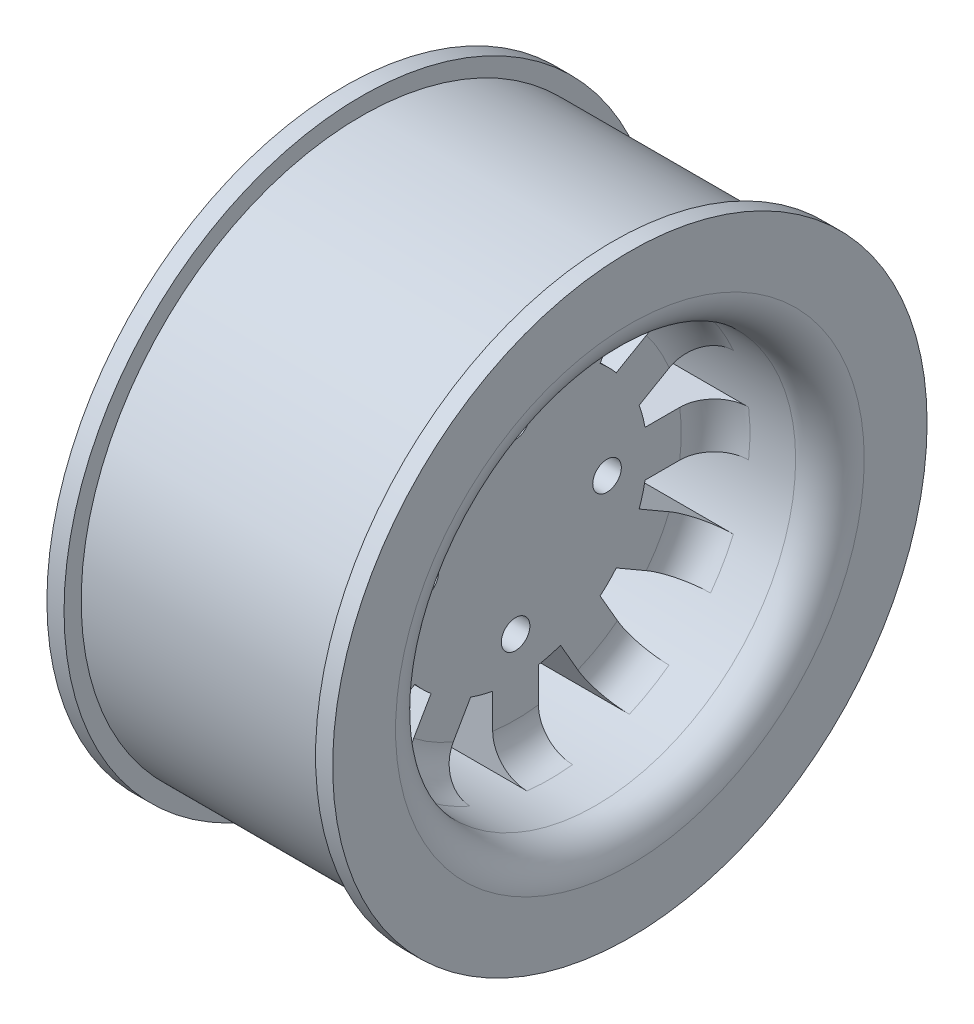
from build123d import *
from build123d.topology import SkipClean

# Parameters (mm, degrees)
SKETCH_1_R          = 24.5
EXTRUDE_1_DEPTH     = 22
SKETCH_2_R          = 26
EXTRUDE_2_DEPTH     = 1.5
EXTRUDE_START       = 1.5
SKETCH_3_R          = 26
EXTRUDE_3_DEPTH     = 1.5
SKETCH_4_R          = 17.5
CUT_EXTRUDE_1_DEPTH = 10
SKETCH_5_R          = 1.25
CUT_EXTRUDE_2_DEPTH = 40.711459303
SKETCH_6_R          = 4.3
SKETCH_6_R_2        = 2.5
EXTRUDE_4_DEPTH     = 10
CUT_EXTRUDE_START   = -10
SKETCH_7_R          = 17.5
CUT_EXTRUDE_3_DEPTH = 10
CUT_EXTRUDE_4_DEPTH = 40.711459303
FILLET_1_R          = 3
FILLET_2_R          = 3


with BuildPart() as part:
    # 草图1 → 凸台-拉伸1 (new body)
    with BuildSketch(Plane(origin=(0, 0, 0), x_dir=(0, 0, -1), z_dir=(1, 0, 0))):
        Circle(SKETCH_1_R)
    extrude(amount=EXTRUDE_1_DEPTH)

    # 草图2 → 凸台-拉伸2 (add)
    with BuildSketch(Plane(origin=(22, 0, 0), x_dir=(0, 0, -1), z_dir=(1, 0, 0))):
        Circle(SKETCH_2_R)
    extrude(amount=EXTRUDE_2_DEPTH)

    # 草图3 → 凸台-拉伸3 (add)
    with BuildSketch(Plane.ZY.offset(EXTRUDE_START)):
        with Locations(Location((0, 0, 0), (0, 0, 180))):
            Circle(SKETCH_3_R)
    extrude(amount=-EXTRUDE_3_DEPTH)

    # 草图4 → 切除-拉伸1 (cut)
    with BuildSketch(Plane.ZY.offset(1.5)):
        Circle(SKETCH_4_R)
    extrude(amount=-CUT_EXTRUDE_1_DEPTH, mode=Mode.SUBTRACT)

    # 草图5 → 切除-拉伸2 (cut, through all)
    with BuildSketch(Plane.ZY.offset(-8.5)):
        with Locations((0, 8)):
            Circle(SKETCH_5_R)
        with Locations((8, 0)):
            Circle(SKETCH_5_R)
        with Locations((0, -8)):
            Circle(SKETCH_5_R)
        with Locations((-8, 0)):
            Circle(SKETCH_5_R)
    extrude(amount=-CUT_EXTRUDE_2_DEPTH, mode=Mode.SUBTRACT)

    # 草图6 → 凸台-拉伸4 (add, through all)
    with BuildSketch(Plane.ZY.offset(-8.5)):
        Circle(SKETCH_6_R)
        Circle(SKETCH_6_R_2, mode=Mode.SUBTRACT)
    extrude(amount=EXTRUDE_4_DEPTH)

    # 草图7 → 切除-拉伸3 (cut)
    with BuildSketch(Plane(origin=(23.5, 0, 0), x_dir=(0, 0, -1), z_dir=(1, 0, 0)).offset(CUT_EXTRUDE_START)):
        with Locations(Location((0, 0, 0), (0, 0, 180))):
            Circle(SKETCH_7_R)
    extrude(amount=CUT_EXTRUDE_3_DEPTH, mode=Mode.SUBTRACT)

    # 草图8 → 切除-拉伸4 (cut, through all)
    with SkipClean():  # the faces are left unmerged after this step: merging them gives an invalid solid
        with BuildSketch(Plane(origin=(13.5, 0, 0), x_dir=(0, 0, -1), z_dir=(1, 0, 0))):
            with BuildLine():
                Line((2, 11.324751653), (2, 17.385338651))
                ThreePointArc((2, 17.385338651), (4.529333289, 16.90370196), (6.960618518, 16.056144925))
                Line((6.960618518, 16.056144925), (3.930325019, 10.807522623))
                ThreePointArc((3.930325019, 10.807522623), (2.976419019, 11.108147002), (2, 11.324751653))
            make_face()
            with BuildLine():
                Line((-2, 11.324751653), (-2, 17.385338651))
                ThreePointArc((-2, 17.385338651), (-4.529333289, 16.90370196), (-6.960618518, 16.056144925))
                Line((-6.960618518, 16.056144925), (-3.930325019, 10.807522623))
                ThreePointArc((-3.930325019, 10.807522623), (-2.976419019, 11.108147002), (-2, 11.324751653))
            make_face()
            with BuildLine():
                Line((7.394426634, 8.807522623), (10.424720133, 14.056144925))
                ThreePointArc((10.424720133, 14.056144925), (12.374368671, 12.374368671), (14.056144925, 10.424720133))
                Line((14.056144925, 10.424720133), (8.807522623, 7.394426634))
                ThreePointArc((8.807522623, 7.394426634), (8.131727984, 8.131727984), (7.394426634, 8.807522623))
            make_face()
            with BuildLine():
                Line((10.807522623, 3.930325019), (16.056144925, 6.960618518))
                ThreePointArc((16.056144925, 6.960618518), (16.90370196, 4.529333289), (17.385338651, 2))
                Line((17.385338651, 2), (11.324751653, 2))
                ThreePointArc((11.324751653, 2), (11.108147002, 2.976419019), (10.807522623, 3.930325019))
            make_face()
            with BuildLine():
                Line((11.324751653, -2), (17.385338651, -2))
                ThreePointArc((17.385338651, -2), (16.90370196, -4.529333289), (16.056144925, -6.960618518))
                Line((16.056144925, -6.960618518), (10.807522623, -3.930325019))
                ThreePointArc((10.807522623, -3.930325019), (11.108147002, -2.976419019), (11.324751653, -2))
            make_face()
            with BuildLine():
                Line((8.807522623, -7.394426634), (14.056144925, -10.424720133))
                ThreePointArc((14.056144925, -10.424720133), (12.374368671, -12.374368671), (10.424720133, -14.056144925))
                Line((10.424720133, -14.056144925), (7.394426634, -8.807522623))
                ThreePointArc((7.394426634, -8.807522623), (8.131727984, -8.131727984), (8.807522623, -7.394426634))
            make_face()
            with BuildLine():
                Line((3.930325019, -10.807522623), (6.960618518, -16.056144925))
                ThreePointArc((6.960618518, -16.056144925), (4.529333289, -16.90370196), (2, -17.385338651))
                Line((2, -17.385338651), (2, -11.324751653))
                ThreePointArc((2, -11.324751653), (2.976419019, -11.108147002), (3.930325019, -10.807522623))
            make_face()
            with BuildLine():
                Line((-2, -11.324751653), (-2, -17.385338651))
                ThreePointArc((-2, -17.385338651), (-4.529333289, -16.90370196), (-6.960618518, -16.056144925))
                Line((-6.960618518, -16.056144925), (-3.930325019, -10.807522623))
                ThreePointArc((-3.930325019, -10.807522623), (-2.976419019, -11.108147002), (-2, -11.324751653))
            make_face()
            with BuildLine():
                Line((-7.394426634, -8.807522623), (-10.424720133, -14.056144925))
                ThreePointArc((-10.424720133, -14.056144925), (-12.374368671, -12.374368671), (-14.056144925, -10.424720133))
                Line((-14.056144925, -10.424720133), (-8.807522623, -7.394426634))
                ThreePointArc((-8.807522623, -7.394426634), (-8.131727984, -8.131727984), (-7.394426634, -8.807522623))
            make_face()
            with BuildLine():
                Line((-10.807522623, -3.930325019), (-16.056144925, -6.960618518))
                ThreePointArc((-16.056144925, -6.960618518), (-16.90370196, -4.529333289), (-17.385338651, -2))
                Line((-17.385338651, -2), (-11.324751653, -2))
                ThreePointArc((-11.324751653, -2), (-11.108147002, -2.976419019), (-10.807522623, -3.930325019))
            make_face()
            with BuildLine():
                Line((-11.324751653, 2), (-17.385338651, 2))
                ThreePointArc((-17.385338651, 2), (-16.90370196, 4.529333289), (-16.056144925, 6.960618518))
                Line((-16.056144925, 6.960618518), (-10.807522623, 3.930325019))
                ThreePointArc((-10.807522623, 3.930325019), (-11.108147002, 2.976419019), (-11.324751653, 2))
            make_face()
            with BuildLine():
                Line((-8.807522623, 7.394426634), (-14.056144925, 10.424720133))
                ThreePointArc((-14.056144925, 10.424720133), (-12.374368671, 12.374368671), (-10.424720133, 14.056144925))
                Line((-10.424720133, 14.056144925), (-7.394426634, 8.807522623))
                ThreePointArc((-7.394426634, 8.807522623), (-8.131727984, 8.131727984), (-8.807522623, 7.394426634))
            make_face()
        extrude(amount=-CUT_EXTRUDE_4_DEPTH, mode=Mode.SUBTRACT)
    add(part.part.scale(1), mode=Mode.REPLACE)  # the faces are merged on a copy

    # 圆角1
    # the kernel refuses this fillet: 3 mm, written as the material it adds along each edge
    with BuildSketch(Plane(origin=(13.5, 0, 0), x_dir=(0, -0.019511048393671137, -0.9998096413770873), z_dir=(0, -0.9998096413770873, 0.019511048393671137))) as fillet_1_piece_1_section:
        with BuildLine():
            CenterArc((17.5 - FILLET_1_R, FILLET_1_R), FILLET_1_R, 270, 90)
            Line((17.5 - FILLET_1_R, 0), (17.5, 0))
            Line((17.5, 0), (17.5, FILLET_1_R))
        make_face()
    fillet_1_piece_1 = revolve(axis=Axis((13.5, 0, 0), (1, 0, 0)), revolution_arc=62.235943332, mode=Mode.PRIVATE)
    fillet_1_piece_1 = split(fillet_1_piece_1, bisect_by=Plane(origin=(14.181189147, 2, -16.789803042), z_dir=(0, -1, 0)), keep=Keep.TOP, mode=Mode.PRIVATE)
    add(fillet_1_piece_1)
    with BuildSketch(Plane(origin=(13.5, 0, 0), x_dir=(0, -0.019511048393671137, -0.9998096413770873), z_dir=(0, -0.9998096413770873, 0.019511048393671137))) as fillet_1_piece_2_section:
        with BuildLine():
            CenterArc((17.5 - FILLET_1_R, FILLET_1_R), FILLET_1_R, 270, 90)
            Line((17.5 - FILLET_1_R, 0), (17.5, 0))
            Line((17.5, 0), (17.5, FILLET_1_R))
        make_face()
    fillet_1_piece_2 = revolve(axis=Axis((13.5, 0, 0), (1, 0, 0)), revolution_arc=62.235943332, mode=Mode.PRIVATE)
    fillet_1_piece_2 = split(fillet_1_piece_2, bisect_by=Plane(origin=(14.179112332, 10.122465498, -13.53262454), z_dir=(0, -0.8660254037844387, -0.5)), keep=Keep.TOP, mode=Mode.PRIVATE)
    fillet_1_piece_2 = split(fillet_1_piece_2, bisect_by=Plane(origin=(14.179112332, 6.658363883, -15.53262454), z_dir=(0, 0.8660254037844387, 0.5000000000000001)), keep=Keep.TOP, mode=Mode.PRIVATE)
    add(fillet_1_piece_2)
    with BuildSketch(Plane(origin=(13.5, 0, 0), x_dir=(0, -0.019511048393671137, -0.9998096413770873), z_dir=(0, -0.9998096413770873, 0.019511048393671137))) as fillet_1_piece_3_section:
        with BuildLine():
            CenterArc((17.5 - FILLET_1_R, FILLET_1_R), FILLET_1_R, 270, 90)
            Line((17.5 - FILLET_1_R, 0), (17.5, 0))
            Line((17.5, 0), (17.5, FILLET_1_R))
        make_face()
    fillet_1_piece_3 = revolve(axis=Axis((13.5, 0, 0), (1, 0, 0)), revolution_arc=62.235943332, mode=Mode.PRIVATE)
    fillet_1_piece_3 = split(fillet_1_piece_3, bisect_by=Plane(origin=(14.181189404, 13.540395949, -10.126952323), z_dir=(0, 0.5000000000000011, 0.866025403784438)), keep=Keep.TOP, mode=Mode.PRIVATE)
    add(fillet_1_piece_3)
    with BuildSketch(Plane(origin=(13.5, 0, 0), x_dir=(0, 0.48300775712515515, -0.8756160725780033), z_dir=(0, -0.8756160725780033, -0.48300775712515515))) as fillet_1_piece_4_section:
        with BuildLine():
            CenterArc((17.5 - FILLET_1_R, FILLET_1_R), FILLET_1_R, 270, 90)
            Line((17.5 - FILLET_1_R, 0), (17.5, 0))
            Line((17.5, 0), (17.5, FILLET_1_R))
        make_face()
    fillet_1_piece_4 = revolve(axis=Axis((13.5, 0, 0), (1, 0, 0)), revolution_arc=62.235943332, mode=Mode.PRIVATE)
    fillet_1_piece_4 = split(fillet_1_piece_4, bisect_by=Plane(origin=(14.181189147, 10.126952328, -13.540395959), z_dir=(0, -0.8660254037844387, -0.5)), keep=Keep.TOP, mode=Mode.PRIVATE)
    add(fillet_1_piece_4)
    with BuildSketch(Plane(origin=(13.5, 0, 0), x_dir=(0, 0.48300775712515515, -0.8756160725780033), z_dir=(0, -0.8756160725780033, -0.48300775712515515))) as fillet_1_piece_5_section:
        with BuildLine():
            CenterArc((17.5 - FILLET_1_R, FILLET_1_R), FILLET_1_R, 270, 90)
            Line((17.5 - FILLET_1_R, 0), (17.5, 0))
            Line((17.5, 0), (17.5, FILLET_1_R))
        make_face()
    fillet_1_piece_5 = revolve(axis=Axis((13.5, 0, 0), (1, 0, 0)), revolution_arc=62.235943332, mode=Mode.PRIVATE)
    fillet_1_piece_5 = split(fillet_1_piece_5, bisect_by=Plane(origin=(14.179112332, 15.53262454, -6.658363883), z_dir=(0, -0.500000000000001, -0.866025403784438)), keep=Keep.TOP, mode=Mode.PRIVATE)
    fillet_1_piece_5 = split(fillet_1_piece_5, bisect_by=Plane(origin=(14.179112332, 13.53262454, -10.122465498), z_dir=(0, 0.5000000000000011, 0.866025403784438)), keep=Keep.TOP, mode=Mode.PRIVATE)
    add(fillet_1_piece_5)
    with BuildSketch(Plane(origin=(13.5, 0, 0), x_dir=(0, 0.48300775712515515, -0.8756160725780033), z_dir=(0, -0.8756160725780033, -0.48300775712515515))) as fillet_1_piece_6_section:
        with BuildLine():
            CenterArc((17.5 - FILLET_1_R, FILLET_1_R), FILLET_1_R, 270, 90)
            Line((17.5 - FILLET_1_R, 0), (17.5, 0))
            Line((17.5, 0), (17.5, FILLET_1_R))
        make_face()
    fillet_1_piece_6 = revolve(axis=Axis((13.5, 0, 0), (1, 0, 0)), revolution_arc=62.235943332, mode=Mode.PRIVATE)
    fillet_1_piece_6 = split(fillet_1_piece_6, bisect_by=Plane(origin=(14.181189404, 16.78980303, -2), z_dir=(0, 0, 1)), keep=Keep.TOP, mode=Mode.PRIVATE)
    add(fillet_1_piece_6)
    with BuildSketch(Plane(origin=(13.5, 0, 0), x_dir=(0, 0.856105024184331, -0.5168018842519312), z_dir=(0, -0.5168018842519312, -0.856105024184331))) as fillet_1_piece_7_section:
        with BuildLine():
            CenterArc((17.5 - FILLET_1_R, FILLET_1_R), FILLET_1_R, 270, 90)
            Line((17.5 - FILLET_1_R, 0), (17.5, 0))
            Line((17.5, 0), (17.5, FILLET_1_R))
        make_face()
    fillet_1_piece_7 = revolve(axis=Axis((13.5, 0, 0), (1, 0, 0)), revolution_arc=62.235943332, mode=Mode.PRIVATE)
    fillet_1_piece_7 = split(fillet_1_piece_7, bisect_by=Plane(origin=(14.181189147, 15.540395959, -6.662850713), z_dir=(0, -0.500000000000001, -0.866025403784438)), keep=Keep.TOP, mode=Mode.PRIVATE)
    add(fillet_1_piece_7)
    with BuildSketch(Plane(origin=(13.5, 0, 0), x_dir=(0, 0.856105024184331, -0.5168018842519312), z_dir=(0, -0.5168018842519312, -0.856105024184331))) as fillet_1_piece_8_section:
        with BuildLine():
            CenterArc((17.5 - FILLET_1_R, FILLET_1_R), FILLET_1_R, 270, 90)
            Line((17.5 - FILLET_1_R, 0), (17.5, 0))
            Line((17.5, 0), (17.5, FILLET_1_R))
        make_face()
    fillet_1_piece_8 = revolve(axis=Axis((13.5, 0, 0), (1, 0, 0)), revolution_arc=62.235943332, mode=Mode.PRIVATE)
    fillet_1_piece_8 = split(fillet_1_piece_8, bisect_by=Plane(origin=(14.179112654, 16.780829062, 2), z_dir=(0, 0, -1)), keep=Keep.TOP, mode=Mode.PRIVATE)
    fillet_1_piece_8 = split(fillet_1_piece_8, bisect_by=Plane(origin=(14.179112654, 16.780829062, -2), z_dir=(0, 0, 1)), keep=Keep.TOP, mode=Mode.PRIVATE)
    add(fillet_1_piece_8)
    with BuildSketch(Plane(origin=(13.5, 0, 0), x_dir=(0, 0.856105024184331, -0.5168018842519312), z_dir=(0, -0.5168018842519312, -0.856105024184331))) as fillet_1_piece_9_section:
        with BuildLine():
            CenterArc((17.5 - FILLET_1_R, FILLET_1_R), FILLET_1_R, 270, 90)
            Line((17.5 - FILLET_1_R, 0), (17.5, 0))
            Line((17.5, 0), (17.5, FILLET_1_R))
        make_face()
    fillet_1_piece_9 = revolve(axis=Axis((13.5, 0, 0), (1, 0, 0)), revolution_arc=62.235943332, mode=Mode.PRIVATE)
    fillet_1_piece_9 = split(fillet_1_piece_9, bisect_by=Plane(origin=(14.181189084, 15.540396221, 6.662850865), z_dir=(0, -0.5000000000000003, 0.8660254037844387)), keep=Keep.TOP, mode=Mode.PRIVATE)
    add(fillet_1_piece_9)
    with BuildSketch(Plane(origin=(13.5, 0, 0), x_dir=(0, 0.9998096413770875, -0.019511048393663653), z_dir=(0, -0.019511048393663653, -0.9998096413770875))) as fillet_1_piece_10_section:
        with BuildLine():
            CenterArc((17.5 - FILLET_1_R, FILLET_1_R), FILLET_1_R, 270, 90)
            Line((17.5 - FILLET_1_R, 0), (17.5, 0))
            Line((17.5, 0), (17.5, FILLET_1_R))
        make_face()
    fillet_1_piece_10 = revolve(axis=Axis((13.5, 0, 0), (1, 0, 0)), revolution_arc=62.235943332, mode=Mode.PRIVATE)
    fillet_1_piece_10 = split(fillet_1_piece_10, bisect_by=Plane(origin=(14.181189467, 16.789802727, 2), z_dir=(0, 0, -1)), keep=Keep.TOP, mode=Mode.PRIVATE)
    add(fillet_1_piece_10)
    with BuildSketch(Plane(origin=(13.5, 0, 0), x_dir=(0, 0.9998096413770875, -0.019511048393663653), z_dir=(0, -0.019511048393663653, -0.9998096413770875))) as fillet_1_piece_11_section:
        with BuildLine():
            CenterArc((17.5 - FILLET_1_R, FILLET_1_R), FILLET_1_R, 270, 90)
            Line((17.5 - FILLET_1_R, 0), (17.5, 0))
            Line((17.5, 0), (17.5, FILLET_1_R))
        make_face()
    fillet_1_piece_11 = revolve(axis=Axis((13.5, 0, 0), (1, 0, 0)), revolution_arc=62.235943332, mode=Mode.PRIVATE)
    fillet_1_piece_11 = split(fillet_1_piece_11, bisect_by=Plane(origin=(14.17911201, 13.532624815, 10.122465657), z_dir=(0, 0.5000000000000001, -0.8660254037844386)), keep=Keep.TOP, mode=Mode.PRIVATE)
    fillet_1_piece_11 = split(fillet_1_piece_11, bisect_by=Plane(origin=(14.17911201, 15.532624815, 6.658364041), z_dir=(0, -0.5000000000000003, 0.8660254037844387)), keep=Keep.TOP, mode=Mode.PRIVATE)
    add(fillet_1_piece_11)
    with BuildSketch(Plane(origin=(13.5, 0, 0), x_dir=(0, 0.9998096413770875, -0.019511048393663653), z_dir=(0, -0.019511048393663653, -0.9998096413770875))) as fillet_1_piece_12_section:
        with BuildLine():
            CenterArc((17.5 - FILLET_1_R, FILLET_1_R), FILLET_1_R, 270, 90)
            Line((17.5 - FILLET_1_R, 0), (17.5, 0))
            Line((17.5, 0), (17.5, FILLET_1_R))
        make_face()
    fillet_1_piece_12 = revolve(axis=Axis((13.5, 0, 0), (1, 0, 0)), revolution_arc=62.235943332, mode=Mode.PRIVATE)
    fillet_1_piece_12 = split(fillet_1_piece_12, bisect_by=Plane(origin=(14.181189404, 10.126952323, 13.540395949), z_dir=(0, -0.866025403784439, 0.4999999999999993)), keep=Keep.TOP, mode=Mode.PRIVATE)
    add(fillet_1_piece_12)
    with BuildSketch(Plane(origin=(13.5, 0, 0), x_dir=(0, 0.8756160725780026, 0.48300775712515664), z_dir=(0, 0.48300775712515664, -0.8756160725780026))) as fillet_1_piece_13_section:
        with BuildLine():
            CenterArc((17.5 - FILLET_1_R, FILLET_1_R), FILLET_1_R, 270, 90)
            Line((17.5 - FILLET_1_R, 0), (17.5, 0))
            Line((17.5, 0), (17.5, FILLET_1_R))
        make_face()
    fillet_1_piece_13 = revolve(axis=Axis((13.5, 0, 0), (1, 0, 0)), revolution_arc=62.235943332, mode=Mode.PRIVATE)
    fillet_1_piece_13 = split(fillet_1_piece_13, bisect_by=Plane(origin=(14.181189147, 13.540395959, 10.126952328), z_dir=(0, 0.5000000000000001, -0.8660254037844386)), keep=Keep.TOP, mode=Mode.PRIVATE)
    add(fillet_1_piece_13)
    with BuildSketch(Plane(origin=(13.5, 0, 0), x_dir=(0, 0.8756160725780026, 0.48300775712515664), z_dir=(0, 0.48300775712515664, -0.8756160725780026))) as fillet_1_piece_14_section:
        with BuildLine():
            CenterArc((17.5 - FILLET_1_R, FILLET_1_R), FILLET_1_R, 270, 90)
            Line((17.5 - FILLET_1_R, 0), (17.5, 0))
            Line((17.5, 0), (17.5, FILLET_1_R))
        make_face()
    fillet_1_piece_14 = revolve(axis=Axis((13.5, 0, 0), (1, 0, 0)), revolution_arc=62.235943332, mode=Mode.PRIVATE)
    fillet_1_piece_14 = split(fillet_1_piece_14, bisect_by=Plane(origin=(14.179112332, 6.658363883, 15.53262454), z_dir=(0, 0.866025403784439, -0.49999999999999933)), keep=Keep.TOP, mode=Mode.PRIVATE)
    fillet_1_piece_14 = split(fillet_1_piece_14, bisect_by=Plane(origin=(14.179112332, 10.122465498, 13.53262454), z_dir=(0, -0.866025403784439, 0.4999999999999993)), keep=Keep.TOP, mode=Mode.PRIVATE)
    add(fillet_1_piece_14)
    with BuildSketch(Plane(origin=(13.5, 0, 0), x_dir=(0, 0.8756160725780026, 0.48300775712515664), z_dir=(0, 0.48300775712515664, -0.8756160725780026))) as fillet_1_piece_15_section:
        with BuildLine():
            CenterArc((17.5 - FILLET_1_R, FILLET_1_R), FILLET_1_R, 270, 90)
            Line((17.5 - FILLET_1_R, 0), (17.5, 0))
            Line((17.5, 0), (17.5, FILLET_1_R))
        make_face()
    fillet_1_piece_15 = revolve(axis=Axis((13.5, 0, 0), (1, 0, 0)), revolution_arc=62.235943332, mode=Mode.PRIVATE)
    fillet_1_piece_15 = split(fillet_1_piece_15, bisect_by=Plane(origin=(14.181189404, 2, 16.78980303), z_dir=(0, -1, 0)), keep=Keep.TOP, mode=Mode.PRIVATE)
    add(fillet_1_piece_15)
    with BuildSketch(Plane(origin=(13.5, 0, 0), x_dir=(0, 0, 1), z_dir=(0, 1, 0))) as fillet_1_piece_16_section:
        with BuildLine():
            CenterArc((17.5 - FILLET_1_R, FILLET_1_R), FILLET_1_R, 270, 90)
            Line((17.5 - FILLET_1_R, 0), (17.5, 0))
            Line((17.5, 0), (17.5, FILLET_1_R))
        make_face()
    fillet_1_piece_16 = revolve(axis=Axis((13.5, 0, 0), (1, 0, 0)), revolution_arc=31.117814376, mode=Mode.PRIVATE)
    fillet_1_piece_16 = split(fillet_1_piece_16, bisect_by=Plane(origin=(14.179112095, -2, 16.780829806), z_dir=(0, 1, 0)), keep=Keep.TOP, mode=Mode.PRIVATE)
    add(fillet_1_piece_16)
    with BuildSketch(Plane(origin=(13.5, 0, 0), x_dir=(0, 0, 1), z_dir=(0, 1, 0))) as fillet_1_piece_17_section:
        with BuildLine():
            CenterArc((17.5 - FILLET_1_R, FILLET_1_R), FILLET_1_R, 270, 90)
            Line((17.5 - FILLET_1_R, 0), (17.5, 0))
            Line((17.5, 0), (17.5, FILLET_1_R))
        make_face()
    fillet_1_piece_17 = revolve(axis=Axis((13.5, 0, 0), (1, 0, 0)), revolution_arc=31.117814376, mode=Mode.PRIVATE)
    fillet_1_piece_17 = split(fillet_1_piece_17, bisect_by=Plane(origin=(14.181189152, -6.662850186, 15.540395046), z_dir=(0, -0.8660254037844387, -0.5000000000000003)), keep=Keep.TOP, mode=Mode.PRIVATE)
    add(fillet_1_piece_17)
    with BuildSketch(Plane(origin=(13.5, 0, 0), x_dir=(0, 0.019511048393670734, 0.9998096413770873), z_dir=(0, 0.9998096413770873, -0.019511048393670734))) as fillet_1_piece_18_section:
        with BuildLine():
            CenterArc((17.5 - FILLET_1_R, FILLET_1_R), FILLET_1_R, 270, 90)
            Line((17.5 - FILLET_1_R, 0), (17.5, 0))
            Line((17.5, 0), (17.5, FILLET_1_R))
        make_face()
    fillet_1_piece_18 = revolve(axis=Axis((13.5, 0, 0), (1, 0, 0)), revolution_arc=62.235943332, mode=Mode.PRIVATE)
    fillet_1_piece_18 = split(fillet_1_piece_18, bisect_by=Plane(origin=(14.181189147, -2, 16.789803042), z_dir=(0, 1, 0)), keep=Keep.TOP, mode=Mode.PRIVATE)
    add(fillet_1_piece_18)
    with BuildSketch(Plane(origin=(13.5, 0, 0), x_dir=(0, 0.019511048393670734, 0.9998096413770873), z_dir=(0, 0.9998096413770873, -0.019511048393670734))) as fillet_1_piece_19_section:
        with BuildLine():
            CenterArc((17.5 - FILLET_1_R, FILLET_1_R), FILLET_1_R, 270, 90)
            Line((17.5 - FILLET_1_R, 0), (17.5, 0))
            Line((17.5, 0), (17.5, FILLET_1_R))
        make_face()
    fillet_1_piece_19 = revolve(axis=Axis((13.5, 0, 0), (1, 0, 0)), revolution_arc=62.235943332, mode=Mode.PRIVATE)
    fillet_1_piece_19 = split(fillet_1_piece_19, bisect_by=Plane(origin=(14.179112332, -10.122465498, 13.53262454), z_dir=(0, 0.8660254037844387, 0.5000000000000003)), keep=Keep.TOP, mode=Mode.PRIVATE)
    fillet_1_piece_19 = split(fillet_1_piece_19, bisect_by=Plane(origin=(14.179112332, -6.658363883, 15.53262454), z_dir=(0, -0.8660254037844387, -0.5000000000000003)), keep=Keep.TOP, mode=Mode.PRIVATE)
    add(fillet_1_piece_19)
    with BuildSketch(Plane(origin=(13.5, 0, 0), x_dir=(0, 0.019511048393670734, 0.9998096413770873), z_dir=(0, 0.9998096413770873, -0.019511048393670734))) as fillet_1_piece_20_section:
        with BuildLine():
            CenterArc((17.5 - FILLET_1_R, FILLET_1_R), FILLET_1_R, 270, 90)
            Line((17.5 - FILLET_1_R, 0), (17.5, 0))
            Line((17.5, 0), (17.5, FILLET_1_R))
        make_face()
    fillet_1_piece_20 = revolve(axis=Axis((13.5, 0, 0), (1, 0, 0)), revolution_arc=62.235943332, mode=Mode.PRIVATE)
    fillet_1_piece_20 = split(fillet_1_piece_20, bisect_by=Plane(origin=(14.181189404, -13.540395949, 10.126952323), z_dir=(0, -0.4999999999999997, -0.866025403784439)), keep=Keep.TOP, mode=Mode.PRIVATE)
    add(fillet_1_piece_20)
    with BuildSketch(Plane(origin=(13.5, 0, 0), x_dir=(0, -0.4830077571251575, 0.8756160725780021), z_dir=(0, 0.8756160725780021, 0.4830077571251575))) as fillet_1_piece_21_section:
        with BuildLine():
            CenterArc((17.5 - FILLET_1_R, FILLET_1_R), FILLET_1_R, 270, 90)
            Line((17.5 - FILLET_1_R, 0), (17.5, 0))
            Line((17.5, 0), (17.5, FILLET_1_R))
        make_face()
    fillet_1_piece_21 = revolve(axis=Axis((13.5, 0, 0), (1, 0, 0)), revolution_arc=62.235943332, mode=Mode.PRIVATE)
    fillet_1_piece_21 = split(fillet_1_piece_21, bisect_by=Plane(origin=(14.181189147, -10.126952328, 13.540395959), z_dir=(0, 0.8660254037844387, 0.5000000000000003)), keep=Keep.TOP, mode=Mode.PRIVATE)
    add(fillet_1_piece_21)
    with BuildSketch(Plane(origin=(13.5, 0, 0), x_dir=(0, -0.4830077571251575, 0.8756160725780021), z_dir=(0, 0.8756160725780021, 0.4830077571251575))) as fillet_1_piece_22_section:
        with BuildLine():
            CenterArc((17.5 - FILLET_1_R, FILLET_1_R), FILLET_1_R, 270, 90)
            Line((17.5 - FILLET_1_R, 0), (17.5, 0))
            Line((17.5, 0), (17.5, FILLET_1_R))
        make_face()
    fillet_1_piece_22 = revolve(axis=Axis((13.5, 0, 0), (1, 0, 0)), revolution_arc=62.235943332, mode=Mode.PRIVATE)
    fillet_1_piece_22 = split(fillet_1_piece_22, bisect_by=Plane(origin=(14.179112332, -15.53262454, 6.658363883), z_dir=(0, 0.4999999999999997, 0.8660254037844389)), keep=Keep.TOP, mode=Mode.PRIVATE)
    fillet_1_piece_22 = split(fillet_1_piece_22, bisect_by=Plane(origin=(14.179112332, -13.53262454, 10.122465498), z_dir=(0, -0.4999999999999997, -0.866025403784439)), keep=Keep.TOP, mode=Mode.PRIVATE)
    add(fillet_1_piece_22)
    with BuildSketch(Plane(origin=(13.5, 0, 0), x_dir=(0, -0.4830077571251575, 0.8756160725780021), z_dir=(0, 0.8756160725780021, 0.4830077571251575))) as fillet_1_piece_23_section:
        with BuildLine():
            CenterArc((17.5 - FILLET_1_R, FILLET_1_R), FILLET_1_R, 270, 90)
            Line((17.5 - FILLET_1_R, 0), (17.5, 0))
            Line((17.5, 0), (17.5, FILLET_1_R))
        make_face()
    fillet_1_piece_23 = revolve(axis=Axis((13.5, 0, 0), (1, 0, 0)), revolution_arc=62.235943332, mode=Mode.PRIVATE)
    fillet_1_piece_23 = split(fillet_1_piece_23, bisect_by=Plane(origin=(14.181189404, -16.78980303, 2), z_dir=(0, 0, -1)), keep=Keep.TOP, mode=Mode.PRIVATE)
    add(fillet_1_piece_23)
    with BuildSketch(Plane(origin=(13.5, 0, 0), x_dir=(0, -0.8561050241843313, 0.5168018842519302), z_dir=(0, 0.5168018842519302, 0.8561050241843313))) as fillet_1_piece_24_section:
        with BuildLine():
            CenterArc((17.5 - FILLET_1_R, FILLET_1_R), FILLET_1_R, 270, 90)
            Line((17.5 - FILLET_1_R, 0), (17.5, 0))
            Line((17.5, 0), (17.5, FILLET_1_R))
        make_face()
    fillet_1_piece_24 = revolve(axis=Axis((13.5, 0, 0), (1, 0, 0)), revolution_arc=62.235943332, mode=Mode.PRIVATE)
    fillet_1_piece_24 = split(fillet_1_piece_24, bisect_by=Plane(origin=(14.181189147, -15.540395959, 6.662850713), z_dir=(0, 0.4999999999999997, 0.8660254037844389)), keep=Keep.TOP, mode=Mode.PRIVATE)
    add(fillet_1_piece_24)
    with BuildSketch(Plane(origin=(13.5, 0, 0), x_dir=(0, -0.8561050241843313, 0.5168018842519302), z_dir=(0, 0.5168018842519302, 0.8561050241843313))) as fillet_1_piece_25_section:
        with BuildLine():
            CenterArc((17.5 - FILLET_1_R, FILLET_1_R), FILLET_1_R, 270, 90)
            Line((17.5 - FILLET_1_R, 0), (17.5, 0))
            Line((17.5, 0), (17.5, FILLET_1_R))
        make_face()
    fillet_1_piece_25 = revolve(axis=Axis((13.5, 0, 0), (1, 0, 0)), revolution_arc=62.235943332, mode=Mode.PRIVATE)
    fillet_1_piece_25 = split(fillet_1_piece_25, bisect_by=Plane(origin=(14.179112332, -16.78082938, -2), z_dir=(0, 0, 1)), keep=Keep.TOP, mode=Mode.PRIVATE)
    fillet_1_piece_25 = split(fillet_1_piece_25, bisect_by=Plane(origin=(14.179112332, -16.78082938, 2), z_dir=(0, 0, -1)), keep=Keep.TOP, mode=Mode.PRIVATE)
    add(fillet_1_piece_25)
    with BuildSketch(Plane(origin=(13.5, 0, 0), x_dir=(0, -0.8561050241843313, 0.5168018842519302), z_dir=(0, 0.5168018842519302, 0.8561050241843313))) as fillet_1_piece_26_section:
        with BuildLine():
            CenterArc((17.5 - FILLET_1_R, FILLET_1_R), FILLET_1_R, 270, 90)
            Line((17.5 - FILLET_1_R, 0), (17.5, 0))
            Line((17.5, 0), (17.5, FILLET_1_R))
        make_face()
    fillet_1_piece_26 = revolve(axis=Axis((13.5, 0, 0), (1, 0, 0)), revolution_arc=62.235943332, mode=Mode.PRIVATE)
    fillet_1_piece_26 = split(fillet_1_piece_26, bisect_by=Plane(origin=(14.181189404, -15.540395949, -6.662850708), z_dir=(0, 0.5000000000000003, -0.8660254037844387)), keep=Keep.TOP, mode=Mode.PRIVATE)
    add(fillet_1_piece_26)
    with BuildSketch(Plane(origin=(13.5, 0, 0), x_dir=(0, -0.9998096413770873, 0.019511048393671078), z_dir=(0, 0.019511048393671078, 0.9998096413770873))) as fillet_1_piece_27_section:
        with BuildLine():
            CenterArc((17.5 - FILLET_1_R, FILLET_1_R), FILLET_1_R, 270, 90)
            Line((17.5 - FILLET_1_R, 0), (17.5, 0))
            Line((17.5, 0), (17.5, FILLET_1_R))
        make_face()
    fillet_1_piece_27 = revolve(axis=Axis((13.5, 0, 0), (1, 0, 0)), revolution_arc=62.235943332, mode=Mode.PRIVATE)
    fillet_1_piece_27 = split(fillet_1_piece_27, bisect_by=Plane(origin=(14.181189147, -16.789803042, -2), z_dir=(0, 0, 1)), keep=Keep.TOP, mode=Mode.PRIVATE)
    add(fillet_1_piece_27)
    with BuildSketch(Plane(origin=(13.5, 0, 0), x_dir=(0, -0.9998096413770873, 0.019511048393671078), z_dir=(0, 0.019511048393671078, 0.9998096413770873))) as fillet_1_piece_28_section:
        with BuildLine():
            CenterArc((17.5 - FILLET_1_R, FILLET_1_R), FILLET_1_R, 270, 90)
            Line((17.5 - FILLET_1_R, 0), (17.5, 0))
            Line((17.5, 0), (17.5, FILLET_1_R))
        make_face()
    fillet_1_piece_28 = revolve(axis=Axis((13.5, 0, 0), (1, 0, 0)), revolution_arc=62.235943332, mode=Mode.PRIVATE)
    fillet_1_piece_28 = split(fillet_1_piece_28, bisect_by=Plane(origin=(14.179112332, -13.53262454, -10.122465498), z_dir=(0, -0.5000000000000003, 0.8660254037844387)), keep=Keep.TOP, mode=Mode.PRIVATE)
    fillet_1_piece_28 = split(fillet_1_piece_28, bisect_by=Plane(origin=(14.179112332, -15.53262454, -6.658363883), z_dir=(0, 0.5000000000000003, -0.8660254037844387)), keep=Keep.TOP, mode=Mode.PRIVATE)
    add(fillet_1_piece_28)
    with BuildSketch(Plane(origin=(13.5, 0, 0), x_dir=(0, -0.9998096413770873, 0.019511048393671078), z_dir=(0, 0.019511048393671078, 0.9998096413770873))) as fillet_1_piece_29_section:
        with BuildLine():
            CenterArc((17.5 - FILLET_1_R, FILLET_1_R), FILLET_1_R, 270, 90)
            Line((17.5 - FILLET_1_R, 0), (17.5, 0))
            Line((17.5, 0), (17.5, FILLET_1_R))
        make_face()
    fillet_1_piece_29 = revolve(axis=Axis((13.5, 0, 0), (1, 0, 0)), revolution_arc=62.235943332, mode=Mode.PRIVATE)
    fillet_1_piece_29 = split(fillet_1_piece_29, bisect_by=Plane(origin=(14.181189404, -10.126952323, -13.540395949), z_dir=(0, 0.8660254037844388, -0.4999999999999996)), keep=Keep.TOP, mode=Mode.PRIVATE)
    add(fillet_1_piece_29)
    with BuildSketch(Plane(origin=(13.5, 0, 0), x_dir=(0, -0.8756160725780022, -0.48300775712515714), z_dir=(0, -0.48300775712515714, 0.8756160725780022))) as fillet_1_piece_30_section:
        with BuildLine():
            CenterArc((17.5 - FILLET_1_R, FILLET_1_R), FILLET_1_R, 270, 90)
            Line((17.5 - FILLET_1_R, 0), (17.5, 0))
            Line((17.5, 0), (17.5, FILLET_1_R))
        make_face()
    fillet_1_piece_30 = revolve(axis=Axis((13.5, 0, 0), (1, 0, 0)), revolution_arc=62.235943332, mode=Mode.PRIVATE)
    fillet_1_piece_30 = split(fillet_1_piece_30, bisect_by=Plane(origin=(14.181189147, -13.540395959, -10.126952328), z_dir=(0, -0.5000000000000003, 0.8660254037844387)), keep=Keep.TOP, mode=Mode.PRIVATE)
    add(fillet_1_piece_30)
    with BuildSketch(Plane(origin=(13.5, 0, 0), x_dir=(0, -0.8756160725780022, -0.48300775712515714), z_dir=(0, -0.48300775712515714, 0.8756160725780022))) as fillet_1_piece_31_section:
        with BuildLine():
            CenterArc((17.5 - FILLET_1_R, FILLET_1_R), FILLET_1_R, 270, 90)
            Line((17.5 - FILLET_1_R, 0), (17.5, 0))
            Line((17.5, 0), (17.5, FILLET_1_R))
        make_face()
    fillet_1_piece_31 = revolve(axis=Axis((13.5, 0, 0), (1, 0, 0)), revolution_arc=62.235943332, mode=Mode.PRIVATE)
    fillet_1_piece_31 = split(fillet_1_piece_31, bisect_by=Plane(origin=(14.179112332, -6.658363883, -15.53262454), z_dir=(0, -0.8660254037844389, 0.4999999999999997)), keep=Keep.TOP, mode=Mode.PRIVATE)
    fillet_1_piece_31 = split(fillet_1_piece_31, bisect_by=Plane(origin=(14.179112332, -10.122465498, -13.53262454), z_dir=(0, 0.8660254037844388, -0.4999999999999996)), keep=Keep.TOP, mode=Mode.PRIVATE)
    add(fillet_1_piece_31)
    with BuildSketch(Plane(origin=(13.5, 0, 0), x_dir=(0, -0.8756160725780022, -0.48300775712515714), z_dir=(0, -0.48300775712515714, 0.8756160725780022))) as fillet_1_piece_32_section:
        with BuildLine():
            CenterArc((17.5 - FILLET_1_R, FILLET_1_R), FILLET_1_R, 270, 90)
            Line((17.5 - FILLET_1_R, 0), (17.5, 0))
            Line((17.5, 0), (17.5, FILLET_1_R))
        make_face()
    fillet_1_piece_32 = revolve(axis=Axis((13.5, 0, 0), (1, 0, 0)), revolution_arc=62.235943332, mode=Mode.PRIVATE)
    fillet_1_piece_32 = split(fillet_1_piece_32, bisect_by=Plane(origin=(14.181189404, -2, -16.78980303), z_dir=(0, 1, 0)), keep=Keep.TOP, mode=Mode.PRIVATE)
    add(fillet_1_piece_32)
    with BuildSketch(Plane(origin=(13.5, 0, 0), x_dir=(0, -0.5168018842519304, -0.8561050241843313), z_dir=(0, -0.8561050241843313, 0.5168018842519304))) as fillet_1_piece_33_section:
        with BuildLine():
            CenterArc((17.5 - FILLET_1_R, FILLET_1_R), FILLET_1_R, 270, 90)
            Line((17.5 - FILLET_1_R, 0), (17.5, 0))
            Line((17.5, 0), (17.5, FILLET_1_R))
        make_face()
    fillet_1_piece_33 = revolve(axis=Axis((13.5, 0, 0), (1, 0, 0)), revolution_arc=62.235943332, mode=Mode.PRIVATE)
    fillet_1_piece_33 = split(fillet_1_piece_33, bisect_by=Plane(origin=(14.181189147, -6.662850713, -15.540395959), z_dir=(0, -0.8660254037844389, 0.4999999999999997)), keep=Keep.TOP, mode=Mode.PRIVATE)
    add(fillet_1_piece_33)
    with BuildSketch(Plane(origin=(13.5, 0, 0), x_dir=(0, -0.5168018842519304, -0.8561050241843313), z_dir=(0, -0.8561050241843313, 0.5168018842519304))) as fillet_1_piece_34_section:
        with BuildLine():
            CenterArc((17.5 - FILLET_1_R, FILLET_1_R), FILLET_1_R, 270, 90)
            Line((17.5 - FILLET_1_R, 0), (17.5, 0))
            Line((17.5, 0), (17.5, FILLET_1_R))
        make_face()
    fillet_1_piece_34 = revolve(axis=Axis((13.5, 0, 0), (1, 0, 0)), revolution_arc=62.235943332, mode=Mode.PRIVATE)
    fillet_1_piece_34 = split(fillet_1_piece_34, bisect_by=Plane(origin=(14.179112332, 2, -16.78082938), z_dir=(0, -1, 0)), keep=Keep.TOP, mode=Mode.PRIVATE)
    fillet_1_piece_34 = split(fillet_1_piece_34, bisect_by=Plane(origin=(14.179112332, -2, -16.78082938), z_dir=(0, 1, 0)), keep=Keep.TOP, mode=Mode.PRIVATE)
    add(fillet_1_piece_34)
    with BuildSketch(Plane(origin=(13.5, 0, 0), x_dir=(0, -0.5168018842519304, -0.8561050241843313), z_dir=(0, -0.8561050241843313, 0.5168018842519304))) as fillet_1_piece_35_section:
        with BuildLine():
            CenterArc((17.5 - FILLET_1_R, FILLET_1_R), FILLET_1_R, 270, 90)
            Line((17.5 - FILLET_1_R, 0), (17.5, 0))
            Line((17.5, 0), (17.5, FILLET_1_R))
        make_face()
    fillet_1_piece_35 = revolve(axis=Axis((13.5, 0, 0), (1, 0, 0)), revolution_arc=62.235943332, mode=Mode.PRIVATE)
    fillet_1_piece_35 = split(fillet_1_piece_35, bisect_by=Plane(origin=(14.181189404, 6.662850708, -15.540395949), z_dir=(0, 0.8660254037844387, 0.5000000000000001)), keep=Keep.TOP, mode=Mode.PRIVATE)
    add(fillet_1_piece_35)
    with BuildSketch(Plane(origin=(13.5, 0, 0), x_dir=(0, 0.5167995340361689, 0.856106442926345), z_dir=(0, 0.856106442926345, -0.5167995340361689))) as fillet_1_piece_36_section:
        with BuildLine():
            CenterArc((17.5 - FILLET_1_R, FILLET_1_R), FILLET_1_R, 270, 90)
            Line((17.5 - FILLET_1_R, 0), (17.5, 0))
            Line((17.5, 0), (17.5, FILLET_1_R))
        make_face()
    fillet_1_piece_36 = revolve(axis=Axis((13.5, 0, 0), (1, 0, 0)), revolution_arc=31.117814376, mode=Mode.PRIVATE)
    fillet_1_piece_36 = split(fillet_1_piece_36, bisect_by=Plane(origin=(14.181188896, 6.662850192, 15.540395056), z_dir=(0, 0.866025403784439, -0.49999999999999933)), keep=Keep.TOP, mode=Mode.PRIVATE)
    add(fillet_1_piece_36)
    with BuildSketch(Plane(origin=(13.5, 0, 0), x_dir=(0, 0.5167995340361689, 0.856106442926345), z_dir=(0, 0.856106442926345, -0.5167995340361689))) as fillet_1_piece_37_section:
        with BuildLine():
            CenterArc((17.5 - FILLET_1_R, FILLET_1_R), FILLET_1_R, 270, 90)
            Line((17.5 - FILLET_1_R, 0), (17.5, 0))
            Line((17.5, 0), (17.5, FILLET_1_R))
        make_face()
    fillet_1_piece_37 = revolve(axis=Axis((13.5, 0, 0), (1, 0, 0)), revolution_arc=31.117814376, mode=Mode.PRIVATE)
    fillet_1_piece_37 = split(fillet_1_piece_37, bisect_by=Plane(origin=(14.179112355, 2, 16.780829803), z_dir=(0, -1, 0)), keep=Keep.TOP, mode=Mode.PRIVATE)
    add(fillet_1_piece_37)

    # 圆角2
    fillet_2_edges = [part.edges().sort_by_distance(p)[0] for p in [
        (-1.5, 1.001642055, 17.471311147),
        (23.5, 0, -17.5),
    ]]
    fillet(fillet_2_edges, radius=FILLET_2_R)


solid = part.part
